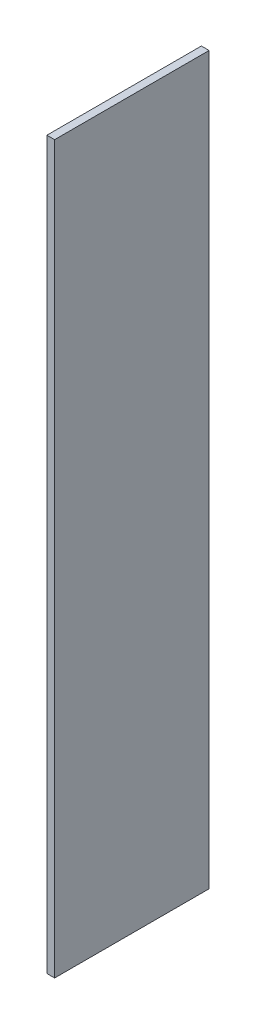
from build123d import *

# Parameters (mm, degrees)
SKETCH1_W           = 63.5
SKETCH1_H           = 298.45
BOSS_EXTRUDE1_DEPTH = 3.175


with BuildPart() as part:
    # Sketch1 → Boss-Extrude1 (new body)
    with BuildSketch(Plane(origin=(0, 0, 0), x_dir=(0, 0, -1), z_dir=(1, 0, 0))):
        with Locations((31.75, 149.225)):
            Rectangle(SKETCH1_W, SKETCH1_H)
    extrude(amount=BOSS_EXTRUDE1_DEPTH)


solid = part.part
